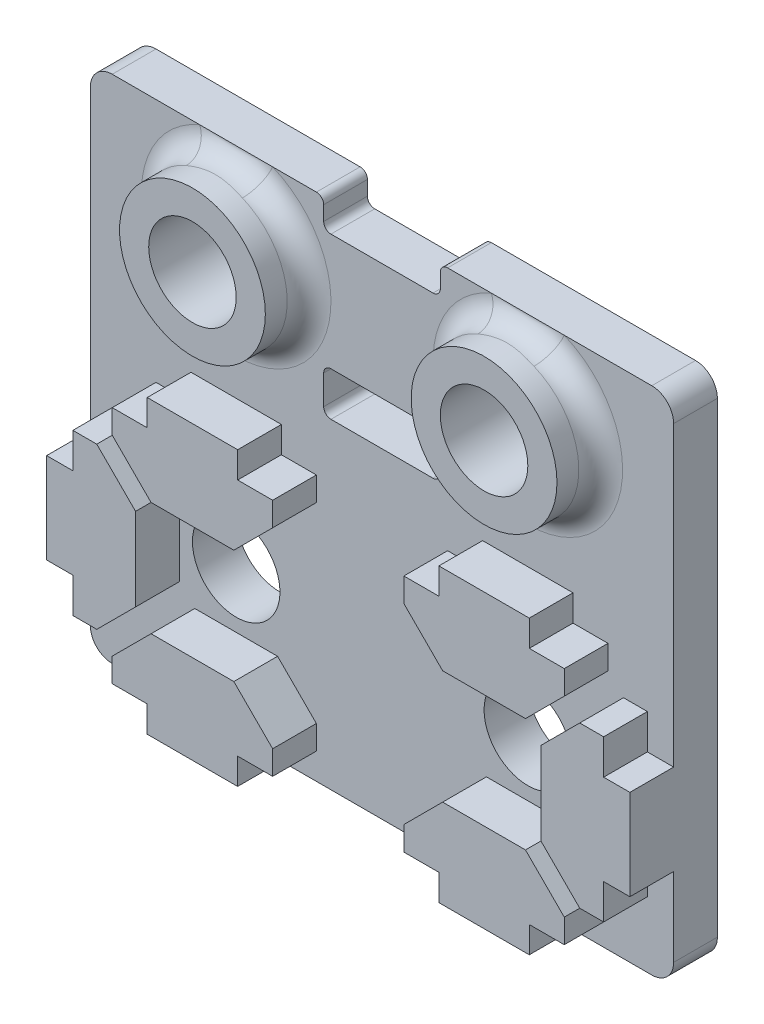
from build123d import *
from build123d.topology import SkipClean

# Parameters (mm, degrees)
SKETCH_1_W          = 40
SKETCH_1_H          = 20
EXTRUDE_1_DEPTH     = 3
EXTRUDE_2_DEPTH     = 3
SKETCH_3_R          = 3
CUT_EXTRUDE_1_DEPTH = 3
SKETCH_4_W          = 40
SKETCH_4_H          = 15
SKETCH_4_R          = 3
EXTRUDE_3_DEPTH     = 3
FILLET_3_R          = 1.5
SKETCH_5_R          = 5
SKETCH_5_R_2        = 3
EXTRUDE_4_DEPTH     = 3
FILLET_4_R          = 1.5
CUT_EXTRUDE_2_DEPTH = 10
FILLET_6_R          = 0.5


with BuildPart() as part:
    # 草图1 → 凸台-拉伸1 (new body)
    with BuildSketch(Plane.XY):
        Rectangle(SKETCH_1_W, SKETCH_1_H)
    extrude(amount=EXTRUDE_1_DEPTH)

    # 草图2 → 凸台-拉伸2 (add)
    with BuildSketch(Plane.XY.offset(3)):
        Polygon((-6.9, 8.2), (-6.9, 10), (-13.1, 10), (-13.1, 8.2), (-15.5, 8.2), (-15.5, 6.560660172), (-12.839339828, 3.9), (-7.160660172, 3.9), (-4.5, 6.560660172), (-4.5, 8.2), align=None)
        Polygon((-16.560660172, 5.5), (-18.2, 5.5), (-18.2, 3.1), (-20, 3.1), (-20, -3.1), (-18.2, -3.1), (-18.2, -5.5), (-16.560660172, -5.5), (-13.9, -2.839339828), (-13.9, 2.839339828), align=None)
        Polygon((-12.839339828, -3.9), (-7.160660172, -3.9), (-4.5, -6.560660172), (-4.5, -8.2), (-6.9, -8.2), (-6.9, -10), (-13.1, -10), (-13.1, -8.2), (-15.5, -8.2), (-15.5, -6.560660172), align=None)
        Polygon((18.2, 3.1), (20, 3.1), (20, -3.1), (18.2, -3.1), (18.2, -5.5), (16.560660172, -5.5), (13.9, -2.839339828), (13.9, 2.839339828), (16.560660172, 5.5), (18.2, 5.5), align=None)
        Polygon((13.1, 8.2), (13.1, 10), (6.9, 10), (6.9, 8.2), (4.5, 8.2), (4.5, 6.560660172), (7.160660172, 3.9), (12.839339828, 3.9), (15.5, 6.560660172), (15.5, 8.2), align=None)
        Polygon((7.160660172, -3.9), (12.839339828, -3.9), (15.5, -6.560660172), (15.5, -8.2), (13.1, -8.2), (13.1, -10), (6.9, -10), (6.9, -8.2), (4.5, -8.2), (4.5, -6.560660172), align=None)
    extrude(amount=EXTRUDE_2_DEPTH)

    # 草图3 → 切除-拉伸1 (cut)
    with BuildSketch(Plane(origin=(0, 0, 0), x_dir=(-1, 0, 0), z_dir=(0, 0, -1))):
        with Locations((-10, 0)):
            Circle(SKETCH_3_R)
        with Locations((10, 0)):
            Circle(SKETCH_3_R)
    extrude(amount=-CUT_EXTRUDE_1_DEPTH, mode=Mode.SUBTRACT)

    # 草图4 → 凸台-拉伸3 (add)
    with BuildSketch(Plane(origin=(0, 0, 0), x_dir=(-1, 0, 0), z_dir=(0, 0, -1))):
        with Locations((0, 17.5)):
            Rectangle(SKETCH_4_W, SKETCH_4_H)
        with Locations((-10, 19)):
            Circle(SKETCH_4_R, mode=Mode.SUBTRACT)
        with Locations((10, 19)):
            Circle(SKETCH_4_R, mode=Mode.SUBTRACT)
    extrude(amount=-EXTRUDE_3_DEPTH)

    # 圆角3
    fillet_3_edges = [part.edges().sort_by_distance(p)[0] for p in [
        (20, -10, 1.5),
        (-20, -10, 1.5),
        (20, 25, 1.5),
        (-20, 25, 1.5),
    ]]
    fillet(fillet_3_edges, radius=FILLET_3_R)

    # 草图5 → 凸台-拉伸4 (add)
    # profile 1 of 2: a face of its own
    with SkipClean():  # the faces are left unmerged after this step: merging them gives an invalid solid
        with BuildSketch(Plane.XY.offset(3)):
            with Locations((-10, 19)):
                Circle(SKETCH_5_R)
            with Locations((-10, 19)):
                Circle(SKETCH_5_R_2, mode=Mode.SUBTRACT)
        # profile 2 of 2: a face of its own
        with BuildSketch(Plane.XY.offset(3)):
            with Locations((10, 19)):
                Circle(SKETCH_5_R)
            with Locations((10, 19)):
                Circle(SKETCH_5_R_2, mode=Mode.SUBTRACT)
        extrude(amount=EXTRUDE_4_DEPTH)
    add(part.part.scale(1), mode=Mode.REPLACE)  # the faces are merged on a copy

    # 圆角4
    fillet_4_edges = [part.edges().sort_by_distance(p)[0] for p in [
        (5, 19, 3),
        (-15, 19, 3),
    ]]
    fillet(fillet_4_edges, radius=FILLET_4_R)

    # 草图6 → 切除-拉伸2 (cut)
    with BuildSketch(Plane(origin=(0, 0, 0), x_dir=(-1, 0, 0), z_dir=(0, 0, -1))):
        Polygon((0, 23.005790595), (4, 23.005790595), (4, 25), (-4, 25), (-4, 23.005790595), align=None)
        Polygon((0, 15.005790595), (-4, 15.005790595), (-4, 12.005790595), (4, 12.005790595), (4, 15.005790595), align=None)
    extrude(amount=-CUT_EXTRUDE_2_DEPTH, mode=Mode.SUBTRACT)

    # 圆角6
    fillet_6_edges = [part.edges().sort_by_distance(p)[0] for p in [
        (4, 23.005790595, 1.5),
        (-4, 23.005790595, 1.5),
        (4, 25, 1.5),
        (-4, 25, 1.5),
        (4, 15.005790595, 1.5),
        (4, 12.005790595, 1.5),
        (-4, 12.005790595, 1.5),
        (-4, 15.005790595, 1.5),
    ]]
    fillet(fillet_6_edges, radius=FILLET_6_R)


solid = part.part
